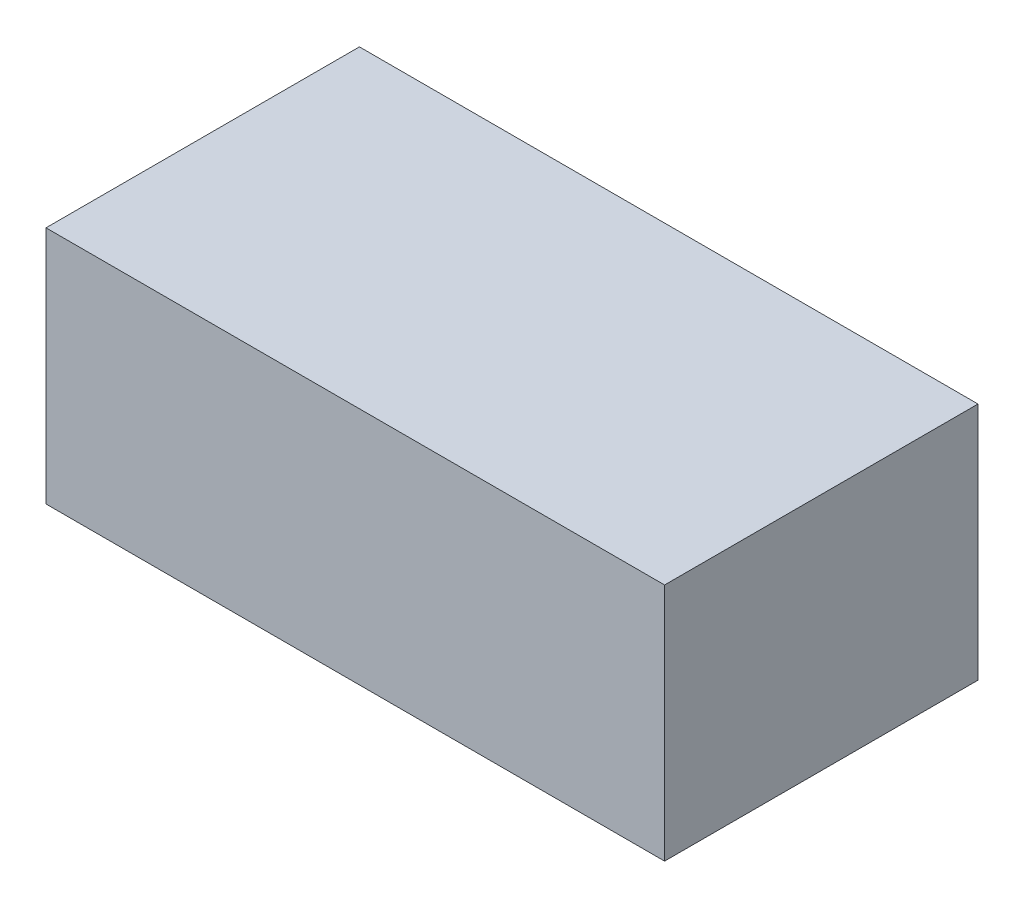
from build123d import *

# Parameters (mm, degrees)
SKETCH1_W           = 75
SKETCH1_H           = 38
BOSS_EXTRUDE1_DEPTH = 29


with BuildPart() as part:
    # Sketch1 → Boss-Extrude1 (new body)
    with BuildSketch(Plane(origin=(0, 0, 0), x_dir=(1, 0, 0), z_dir=(0, 1, 0))):
        Rectangle(SKETCH1_W, SKETCH1_H)
    extrude(amount=BOSS_EXTRUDE1_DEPTH)


solid = part.part
